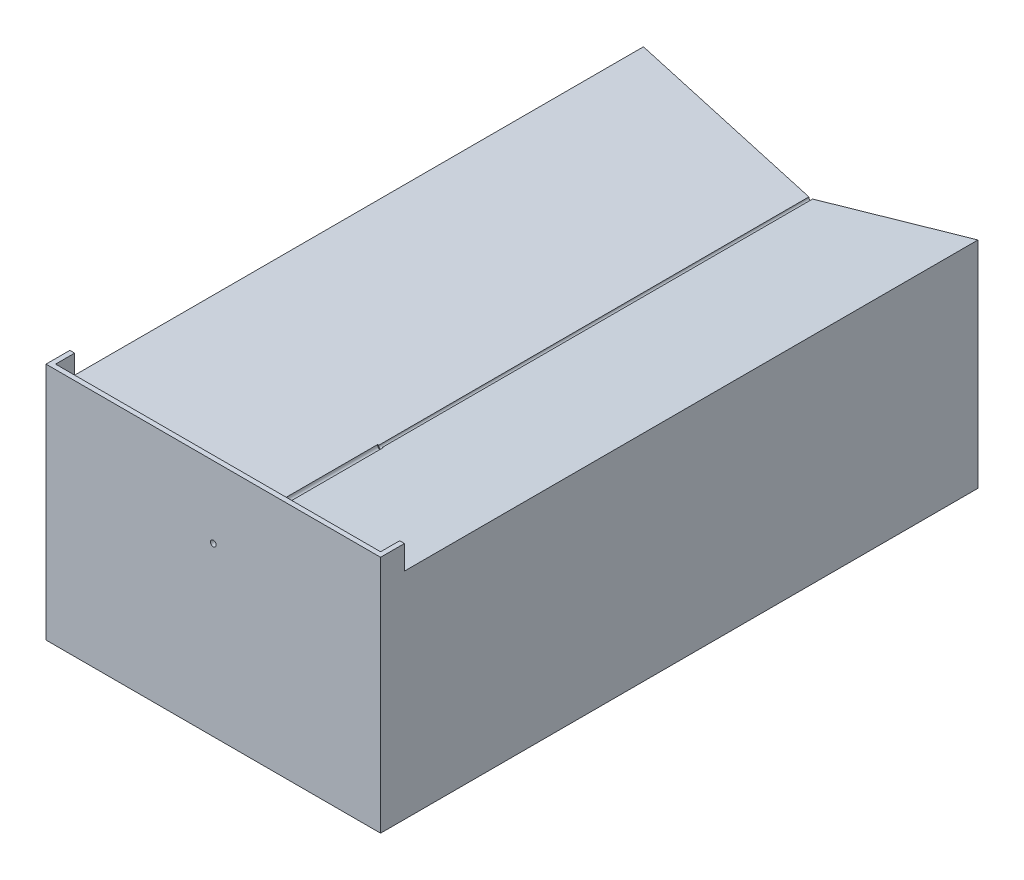
from build123d import *

# Parameters (mm, degrees)
RESSALTO_EXTRUS_O2_DEPTH = 120
ESBO_O2_W                = 70
ESBO_O2_H                = 50
RESSALTO_EXTRUS_O3_DEPTH = 5
ESBO_O3_W                = 68
ESBO_O3_H                = 4
CORTE_EXTRUS_O1_DEPTH    = 48
ESBO_O5_R                = 0.4
CORTE_EXTRUS_O4_DEPTH    = 127
ESBO_O6_R                = 0.6
CORTE_EXTRUS_O6_DEPTH    = 35


with BuildPart() as part:
    # Esboço1 → Ressalto-extrusão2 (new body)
    with BuildSketch(Plane.XY):
        with BuildLine():
            Line((35, -22.5), (-35, -22.5))
            Line((-35, -22.5), (-35, 22.5))
            Line((-35, 22.5), (-0.384609579, 12.609888451))
            ThreePointArc((-0.384609579, 12.609888451), (0, 12.1), (0.384609579, 12.609888451))
            Line((0.384609579, 12.609888451), (35, 22.5))
            Line((35, 22.5), (35, -22.5))
        make_face()
    extrude(amount=RESSALTO_EXTRUS_O2_DEPTH)

    # Esboço2 → Ressalto-extrusão3 (add)
    with BuildSketch(Plane.XY.offset(120)):
        with Locations((0, 2.5)):
            Rectangle(ESBO_O2_W, ESBO_O2_H)
    extrude(amount=RESSALTO_EXTRUS_O3_DEPTH)

    # Esboço3 → Corte-extrusão1 (cut)
    with BuildSketch(Plane(origin=(0, 27.5, 0), x_dir=(1, 0, 0), z_dir=(0, 1, 0))):
        with Locations((0, -122)):
            Rectangle(ESBO_O3_W, ESBO_O3_H)
    extrude(amount=-CORTE_EXTRUS_O1_DEPTH, mode=Mode.SUBTRACT)

    # Esboço5 → Corte-extrusão4 (cut)
    with BuildSketch(Plane(origin=(0, 0, 0), x_dir=(-1, 0, 0), z_dir=(0, 0, -1))):
        with Locations((0, 12.5)):
            Circle(ESBO_O5_R)
    extrude(amount=-CORTE_EXTRUS_O4_DEPTH, mode=Mode.SUBTRACT)

    # Esboço6 → Corte-extrusão6 (cut)
    with BuildSketch(Plane.XY.offset(125)):
        with Locations((0, 12.5)):
            Circle(ESBO_O6_R)
    extrude(amount=-CORTE_EXTRUS_O6_DEPTH, mode=Mode.SUBTRACT)


solid = part.part
